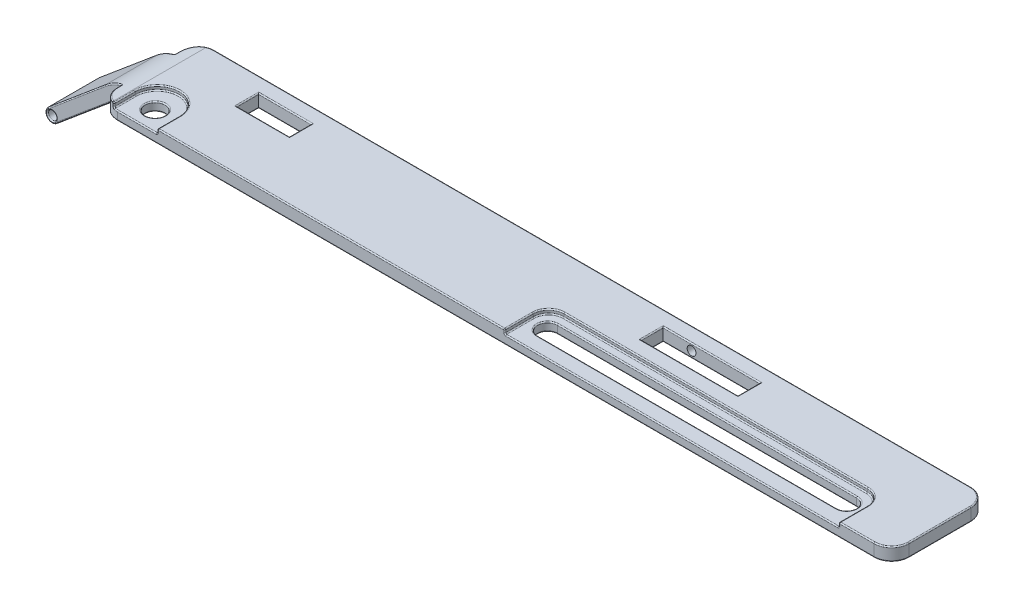
from build123d import *

# Parameters (mm, degrees)
BOSS_EXTRUDE1_DEPTH                        = 11
BOSS_EXTRUDE1_DEPTH_BACK                   = 11
SKETCH1_R                                  = 1
SKETCH2_W                                  = 30.149933191
SKETCH2_H                                  = 27.250901153
CUT_EXTRUDE1_DEPTH                         = 5
SKETCH3_W                                  = 71.820543682
SKETCH3_H                                  = 83.600632857
CUT_EXTRUDE2_DEPTH                         = 5
CUT_EXTRUDE3_REACH                         = 200.411
SKETCH4_W                                  = 22
SKETCH4_H                                  = 5
SKETCH4_W_2                                = 12
CUT_EXTRUDE4_DEPTH                         = 1
CUT_EXTRUDE5_REACH                         = 200.411
SKETCH6_R                                  = 2.25
FILLET1_R                                  = 4
FILLET2_R                                  = 0.25
F_1_16_0_07874016_DIAMETER_HOLE1_OUTLINE_W = 1.000000032
F_1_16_0_07874016_DIAMETER_HOLE1_OUTLINE_H = 3.5


# Read off the part's stored shape, not the designer's step: 1/16 (0.07874016) Diameter Hole1
with BuildPart() as part:
    # Sketch1 → Boss-Extrude1 (new, two sides: drawn at the far end of the back side and taken through both)
    with BuildSketch(Plane.XY.offset(-BOSS_EXTRUDE1_DEPTH_BACK)):
        with BuildLine():
            Line((-182.788173754, -2.339555569), (-195, -12.586494468))
            ThreePointArc((-195, -12.586494468), (-197.113248079, -12.401609218), (-196.928362829, -10.288361138))
            Line((-196.928362829, -10.288361138), (-183.880084457, 0.660444431))
            ThreePointArc((-183.880084457, 0.660444431), (-180.872409793, 2.396926208), (-177.45220836, 3))
            Line((-177.45220836, 3), (0, 3))
            Line((0, 3), (0, 0))
            Line((0, 0), (-176.360297657, 0))
            ThreePointArc((-176.360297657, 0), (-179.780499091, -0.603073792), (-182.788173754, -2.339555569))
        make_face()
        with Locations((-195.964181415, -11.437427803)):
            Circle(SKETCH1_R, mode=Mode.SUBTRACT)
    extrude(amount=BOSS_EXTRUDE1_DEPTH + BOSS_EXTRUDE1_DEPTH_BACK)

    # Sketch2 → Cut-Extrude1 (cut)
    with BuildSketch(Plane.XY.offset(11)):
        with Locations((-195.074966596, -3.959703737)):
            Rectangle(SKETCH2_W, SKETCH2_H)
    extrude(amount=-CUT_EXTRUDE1_DEPTH, mode=Mode.SUBTRACT)

    # Sketch3 → Cut-Extrude2 (cut)
    with BuildSketch(Plane(origin=(0, 0, -11), x_dir=(-1, 0, 0), z_dir=(0, 0, -1))):
        with Locations((215.910271841, -13.071084551)):
            Rectangle(SKETCH3_W, SKETCH3_H)
    extrude(amount=-CUT_EXTRUDE2_DEPTH, mode=Mode.SUBTRACT)

    # Sketch4 → Cut-Extrude3 (cut, up to next)
    with BuildSketch(Plane(origin=(0, 3, 0), x_dir=(1, 0, 0), z_dir=(0, 1, 0)), mode=Mode.PRIVATE) as cut_extrude3_sk1:
        with Locations((-59.45220836, 5)):
            Rectangle(SKETCH4_W, SKETCH4_H)
    cut_extrude3_tool1 = extrude(cut_extrude3_sk1.sketch, amount=-CUT_EXTRUDE3_REACH, mode=Mode.PRIVATE) & part.part
    # Sketch4 → Cut-Extrude3 (cut, up to next)
    with BuildSketch(Plane(origin=(0, 3, 0), x_dir=(1, 0, 0), z_dir=(0, 1, 0)), mode=Mode.PRIVATE) as cut_extrude3_sk2:
        with Locations((-156.45220836, 5)):
            Rectangle(SKETCH4_W_2, SKETCH4_H)
    cut_extrude3_tool2 = extrude(cut_extrude3_sk2.sketch, amount=-CUT_EXTRUDE3_REACH, mode=Mode.PRIVATE) & part.part
    add(cut_extrude3_tool1.solids().sort_by_distance((-59.452208, 3, -5))[0], mode=Mode.SUBTRACT)
    add(cut_extrude3_tool2.solids().sort_by_distance((-156.452208, 3, -5))[0], mode=Mode.SUBTRACT)

    # Sketch5 → Cut-Extrude4 (cut)
    with BuildSketch(Plane(origin=(0, 3, 0), x_dir=(1, 0, 0), z_dir=(0, 1, 0))):
        with BuildLine():
            Line((-84.5, -1), (-15.5, -1))
            ThreePointArc((-15.5, -1), (-13.025126266, -2.025126266), (-12, -4.5))
            Line((-12, -4.5), (-12, -11))
            Line((-12, -11), (-88, -11))
            Line((-88, -11), (-88, -4.5))
            ThreePointArc((-88, -4.5), (-86.974873734, -2.025126266), (-84.5, -1))
        make_face()
        with BuildLine():
            Line((-177, -6), (-177, -11))
            Line((-177, -11), (-167, -11))
            Line((-167, -11), (-167, -6))
            ThreePointArc((-167, -6), (-172, -1), (-177, -6))
        make_face()
    extrude(amount=-CUT_EXTRUDE4_DEPTH, mode=Mode.SUBTRACT)

    # Sketch6 → Cut-Extrude5 (cut, up to next)
    with BuildSketch(Plane(origin=(0, 3, 0), x_dir=(1, 0, 0), z_dir=(0, 1, 0)), mode=Mode.PRIVATE) as cut_extrude5_sk1:
        with Locations(Location((-172, -6.5, 0), (0, 0, 90))):
            Circle(SKETCH6_R)
    cut_extrude5_tool1 = extrude(cut_extrude5_sk1.sketch, amount=-CUT_EXTRUDE5_REACH, mode=Mode.PRIVATE) & part.part
    # Sketch6 → Cut-Extrude5 (cut, up to next)
    with BuildSketch(Plane(origin=(0, 3, 0), x_dir=(1, 0, 0), z_dir=(0, 1, 0)), mode=Mode.PRIVATE) as cut_extrude5_sk2:
        with BuildLine():
            Line((-84, -3), (-16, -3))
            ThreePointArc((-16, -3), (-13.75, -5.25), (-16, -7.5))
            Line((-16, -7.5), (-84, -7.5))
            ThreePointArc((-84, -7.5), (-86.25, -5.25), (-84, -3))
        make_face()
    cut_extrude5_tool2 = extrude(cut_extrude5_sk2.sketch, amount=-CUT_EXTRUDE5_REACH, mode=Mode.PRIVATE) & part.part
    add(cut_extrude5_tool1.solids().sort_by_distance((-172, 3, 6.5))[0], mode=Mode.SUBTRACT)
    add(cut_extrude5_tool2.solids().sort_by_distance((-50, 3, 5.25))[0], mode=Mode.SUBTRACT)

    # Fillet1
    fillet1_edges = [part.edges().sort_by_distance(p)[0] for p in [
        (-180, 0.992049223, 11),
        (-180, 0.992049223, -11),
        (0, 1.5, 11),
        (0, 1.5, -11),
    ]]
    fillet(fillet1_edges, radius=FILLET1_R)

    # Fillet2
    fillet2_edges = [part.edges().sort_by_distance(p)[0] for p in [
        (-70.45220836, 0, -5),
        (-59.45220836, 0, -7.5),
        (-48.45220836, 0, -5),
        (-59.45220836, 0, -2.5),
        (-70.45220836, 3, -5),
        (-59.45220836, 3, -2.5),
        (-48.45220836, 3, -5),
        (-59.45220836, 3, -7.5),
        (-162.45220836, 0, -5),
        (-156.45220836, 0, -7.5),
        (-150.45220836, 0, -5),
        (-156.45220836, 0, -2.5),
        (-162.45220836, 3, -5),
        (-156.45220836, 3, -2.5),
        (-150.45220836, 3, -5),
        (-156.45220836, 3, -7.5),
        (-127.5, 3, 11),
        (-86.974873734, 2, 2.025126266),
        (-50, 2, 1),
        (-13.025126266, 2, 2.025126266),
        (-12, 2, 7.75),
        (-50, 2, 11),
        (-12, 2.5, 11),
        (-88, 2, 7.75),
        (-88, 2.5, 11),
        (-86.974873734, 3, 2.025126266),
        (-88, 3, 7.75),
        (-12, 3, 7.75),
        (-13.025126266, 3, 2.025126266),
        (-50, 3, 1),
        (-172, 2, 1),
        (-167, 2, 8.5),
        (-167, 2.5, 11),
        (-177, 2, 8.436491673),
        (-172, 3, 1),
        (-177, 3, 8.436491673),
        (-167, 3, 8.5),
        (-86.25, 0, 5.25),
        (-86.25, 2, 5.25),
        (-50, 0, 3),
        (-50, 2, 3),
        (-13.75, 0, 5.25),
        (-13.75, 2, 5.25),
        (-50, 0, 7.5),
        (-50, 2, 7.5),
        (-172, 2, 8.75),
        (-172, 0, 8.75),
        (-180, 2.669992645, 6.5),
        (-179.394637624, 2.809534579, -9.115758844),
        (-179.39451804, 2.809558256, 9.115950694),
        (-8, 3, 11),
        (0, 3, 0),
        (-90, 3, -11),
        (-1.171572875, 3, -9.828427125),
        (-1.171572875, 3, 9.828427125),
        (-176.738816109, 3, -10.931176765),
        (-177.228272667, 3, 10.806750091),
        (-177, 2.5, 10.872983346),
        (-171.5, 2, 11),
        (-176.50401717, 2, 10.968118785),
        (-90, 0, 11),
        (0, 0, 0),
        (-90, 0, -11),
        (-1.171572875, 0, -9.828427125),
        (-1.171572875, 0, 9.828427125),
        (-176.180332183, 0, -10.99593297),
        (-176.180332183, 0, 10.99593297),
        (-180, -0.6858942, -6.5),
        (-179.130203098, -0.391273546, -9.490347117),
        (-179.130203144, -0.391273559, 9.490347059),
        (-181.461540926, -1.39899325, 6),
        (-188.894086877, -7.463025018, 6),
        (-197.113248079, -12.401609218, 6),
        (-190.404223643, -4.813958354, 6),
        (-182.051145611, 1.879739645, 6),
        (-180, -0.6858942, 6.5),
        (-180, 0.992049223, 6),
        (-196.964181415, -11.437427803, 6),
        (-182.051145611, 1.879739645, -6),
        (-188.894086877, -7.463025018, -6),
        (-181.461540926, -1.39899325, -6),
        (-190.404223643, -4.813958354, -6),
        (-197.113248079, -12.401609218, -6),
        (-180, 2.669992645, -6.5),
        (-180, 0.992049223, -6),
        (-196.964181415, -11.437427803, -6),
    ]]
    fillet(fillet2_edges, radius=FILLET2_R - 0.0001)  # a hair under: the kernel refuses the full size

    # 1/16 (0.07874016) Diameter Hole1 outline → 1/16 (0.07874016) Diameter Hole1 (revolve, cut)
    with BuildSketch(Plane(origin=(-64, 1.5, 0), x_dir=(1, 0, 0), z_dir=(0, -1, 0))):
        Polygon((1.000000032, 0.399139362), (0, 1), (0, -2.5), (1.000000032, -2.5), align=None)
        with Locations((0.500000016, -9.25)):
            Rectangle(F_1_16_0_07874016_DIAMETER_HOLE1_OUTLINE_W, F_1_16_0_07874016_DIAMETER_HOLE1_OUTLINE_H)
    revolve(axis=Axis((-64, 1.5, 0), (0, 0, 1)), mode=Mode.SUBTRACT)


solid = part.part
